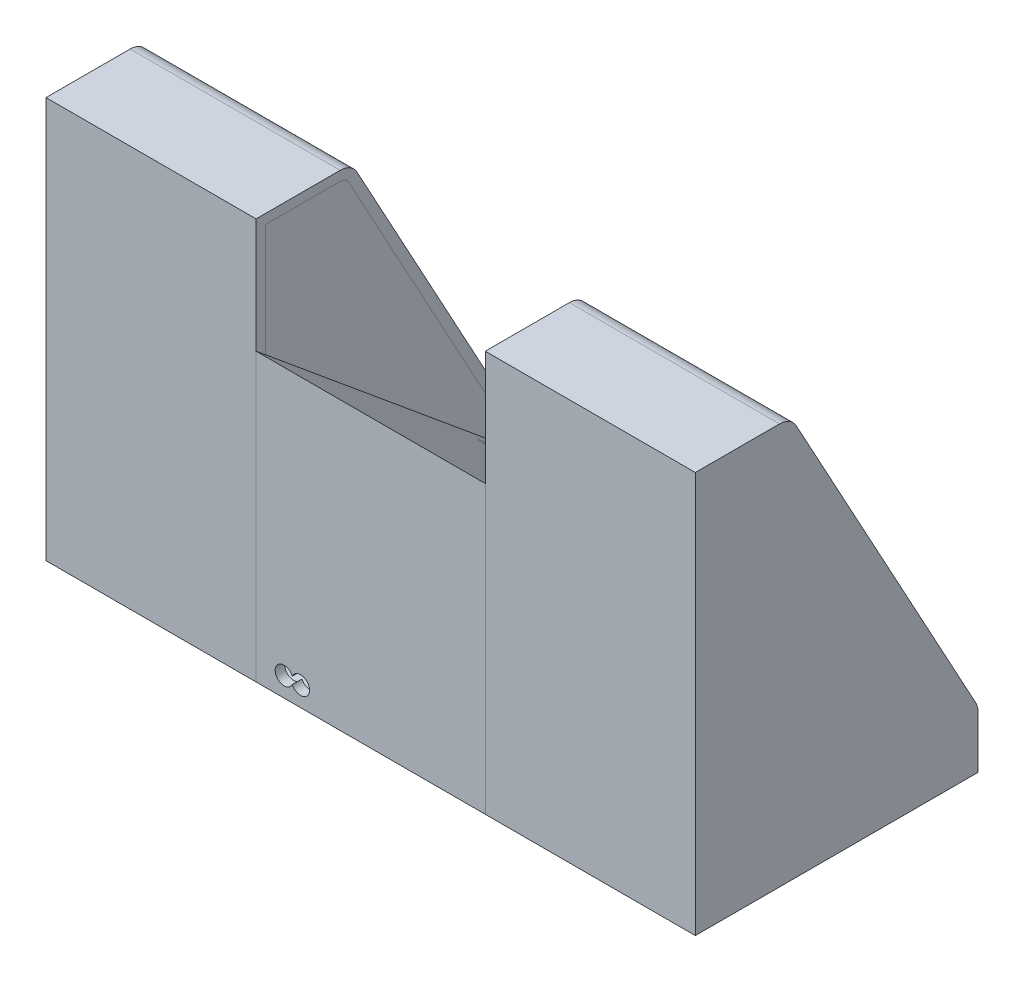
from build123d import *

# Parameters (mm, degrees)
SKETCH1_W               = 148
SKETCH1_H               = 210
BOSS_EXTRUDE1_DEPTH     = 110
SPLIT1_SURFACE_1_BACK   = 280.471
SPLIT1_SURFACE_1_DEPTH  = 560.942
FILLET1_R               = 10
SHELL2_T                = -5
THICKEN1_DEPTH          = 5
BOSS_EXTRUDE2_DEPTH     = 120
FILLET2_R               = 10
SHELL3_T                = -5
SKETCH4_R               = 5
CUT_EXTRUDE1_DEPTH      = 10
CUT_EXTRUDE2_DEPTH      = 5
CUT_EXTRUDE3_DEPTH      = 40
CUT_EXTRUDE3_DEPTH_BACK = 40
FILLET3_R               = 10


# Read off the part's stored shape, not the designer's step: Thicken1
with BuildPart() as part:
    # Sketch1 → Boss-Extrude1 (new body)
    with BuildSketch(Plane(origin=(0, 0, 0), x_dir=(0, 0, -1), z_dir=(1, 0, 0))):
        with Locations((74, 105)):
            Rectangle(SKETCH1_W, SKETCH1_H)
    extrude(amount=BOSS_EXTRUDE1_DEPTH)

    # Split1: cut with a surface, the side behind it stays
    # Split1 surface: a surface, the sketch's curves swept straight by 560.942 mm
    with BuildLine(Plane(origin=(110, 0, 0), x_dir=(0, 0, -1), z_dir=(1, 0, 0)).offset(-SPLIT1_SURFACE_1_BACK), mode=Mode.PRIVATE) as split1_surface_1_path:
        Line((50, 210), (148, 30))
    split1_surface_1 = Shell.extrude(split1_surface_1_path.wire(), (1 * SPLIT1_SURFACE_1_DEPTH, 0 * SPLIT1_SURFACE_1_DEPTH, 0 * SPLIT1_SURFACE_1_DEPTH))
    split(bisect_by=split1_surface_1, keep=Keep.BOTTOM)

    # Fillet1
    fillet1_edges = [part.edges().sort_by_distance(p)[0] for p in [
        (55, 210, -50),
        (55, 30, -148),
    ]]
    fillet(fillet1_edges, radius=FILLET1_R)

    # Shell2
    shell2_openings = [part.faces().sort_by_distance(p)[0] for p in [
        (0, 87.139420884, -57.622655137),
    ]]
    offset(amount=SHELL2_T, openings=shell2_openings, kind=Kind.INTERSECTION)


with BuildPart() as body_2:
    # Thicken1 outline → Thicken1 (new body)
    with BuildSketch(Plane.YZ):
        with BuildLine():
            ThreePointArc((27.454206726, -143), (28.68775727, -142.845446631), (29.845048058, -142.391341222))
            Line((29.845048058, -142.391341222), (202.390841332, -48.449742661))
            ThreePointArc((202.390841332, -48.449742661), (204.298500126, -46.612397656), (205, -44.05840144))
            Line((205, -44.05840144), (205, -5))
            Line((205, -5), (5, -5))
            Line((5, -5), (5, -143))
            Line((5, -143), (27.454206726, -143))
        make_face()
    extrude(amount=THICKEN1_DEPTH)


with BuildPart() as body_3:
    # Mirror1: mirrored copy
    add(part.part.mirror(Plane(origin=(-60, 0, 0), x_dir=(0, 0, 1), z_dir=(1, 0, 0))))


with BuildPart() as body_4:
    # Mirror1 2: mirrored copy
    add(body_2.part.mirror(Plane(origin=(-60, 0, 0), x_dir=(0, 0, 1), z_dir=(1, 0, 0))))


with BuildPart() as body_5:
    # Sketch3 → Boss-Extrude2 (new body)
    with BuildSketch(Plane.ZY):
        Polygon((-148, 27.454206726), (0, 150), (0, 0), (-148, 0), align=None)
    extrude(amount=BOSS_EXTRUDE2_DEPTH)

    # Fillet2
    fillet2_edges = [body_5.edges().sort_by_distance(p)[0] for p in [
        (-60, 27.454206726, -148),
    ]]
    fillet(fillet2_edges, radius=FILLET2_R)

    # Shell3
    shell3_openings = [body_5.faces().sort_by_distance(p)[0] for p in [
        (0, 51.421511448, -56.944660016),
    ]]
    offset(amount=SHELL3_T, openings=shell3_openings, kind=Kind.INTERSECTION)


with BuildPart() as cut_extrude1_tool:
    # Sketch4 → Cut-Extrude1 (new body)
    with BuildSketch(Plane(origin=(-115, 0, 0), x_dir=(0, 0, -1), z_dir=(1, 0, 0))):
        with Locations((25, 15)):
            Circle(SKETCH4_R)
    extrude(amount=-CUT_EXTRUDE1_DEPTH)


with BuildPart() as body_4_1:
    add(body_4.part)

    # Cut-Extrude1: cut by cut_extrude1_tool
    add(cut_extrude1_tool.part, mode=Mode.SUBTRACT)


with BuildPart() as body_5_1:
    add(body_5.part)

    # Cut-Extrude1: cut by cut_extrude1_tool
    add(cut_extrude1_tool.part, mode=Mode.SUBTRACT)

    # Sketch5 → Cut-Extrude2 (cut)
    with BuildSketch(Plane.XY):
        with BuildLine():
            ThreePointArc((-101, 12.147366596), (-110, 10.25), (-101, 8.352633404))
            ThreePointArc((-101, 8.352633404), (-92, 10.25), (-101, 12.147366596))
        make_face()
    extrude(amount=-CUT_EXTRUDE2_DEPTH, mode=Mode.SUBTRACT)

    # Sketch7 → Cut-Extrude3 (cut, two sides: drawn at the far end of the back side and taken through both)
    with BuildSketch(Plane(origin=(-60, 0, 0), x_dir=(0, 0, -1), z_dir=(1, 0, 0)).offset(-CUT_EXTRUDE3_DEPTH_BACK)):
        Polygon((128.0174503, 44), (108.0174503, 44), (108.0174503, 60.560242334), align=None)
    extrude(amount=CUT_EXTRUDE3_DEPTH + CUT_EXTRUDE3_DEPTH_BACK, mode=Mode.SUBTRACT)

    # Fillet3
    # the kernel refuses this fillet: 10 mm, written as the material it takes off along each edge
    with BuildSketch(Plane(origin=(-100, 74.368203197, -91.341413097), x_dir=(-1, 0, 0), z_dir=(0, -0.6377623937017006, -0.77023316546347))) as fillet3_piece_1_section:
        with BuildLine():
            CenterArc((8.660254038, -10), FILLET3_R, 90, 60)
            Line((0, -5), (-0.173205081, -4.9))
            ThreePointArc((-0.173205081, -4.9), (-0.2, -2.5), (-0.2, 0))
            Line((-0.2, 0), (0, 0.2))
            Line((0, 0.2), (8.660254038, 0.2))
            Line((8.660254038, 0.2), (8.660254038, 0))
        make_face()
    fillet3_piece_1 = extrude(amount=69.26743329, mode=Mode.PRIVATE)
    fillet3_piece_1 = split(fillet3_piece_1, bisect_by=Plane(origin=(-102.283215667, 51.522014341, -108.0174503), z_dir=(0, 0, -1)), keep=Keep.TOP, mode=Mode.PRIVATE)
    fillet3_piece_1 = split(fillet3_piece_1, bisect_by=Plane(origin=(-102.283215667, 44, -117.101875744), z_dir=(0, 1, 0)), keep=Keep.TOP, mode=Mode.PRIVATE)
    with BuildSketch(Plane(origin=(-20, 74.368203197, -91.341413097), x_dir=(1, 0, 0), z_dir=(0, -0.6377623937017006, -0.77023316546347))) as fillet3_piece_2_section:
        with BuildLine():
            CenterArc((8.660254038, 10), FILLET3_R, 210, 60)
            Line((0, 5), (-0.173205081, 4.9))
            ThreePointArc((-0.173205081, 4.9), (-0.2, 2.5), (-0.2, 0))
            Line((-0.2, 0), (0, -0.2))
            Line((0, -0.2), (8.660254038, -0.2))
            Line((8.660254038, -0.2), (8.660254038, 0))
        make_face()
    fillet3_piece_2 = extrude(amount=69.26743329, mode=Mode.PRIVATE)
    fillet3_piece_2 = split(fillet3_piece_2, bisect_by=Plane(origin=(-17.716784333, 51.522014341, -108.0174503), z_dir=(0, 0, -1)), keep=Keep.TOP, mode=Mode.PRIVATE)
    fillet3_piece_2 = split(fillet3_piece_2, bisect_by=Plane(origin=(-17.716784333, 44, -117.101875744), z_dir=(0, 1, 0)), keep=Keep.TOP, mode=Mode.PRIVATE)
    with BuildSketch(Plane(origin=(-100, 60.560242334, -108.0174503), x_dir=(0, 0.6377623937017001, 0.7702331654634703), z_dir=(1, 0, 0))) as fillet3_piece_3:
        with BuildLine():
            CenterArc((FILLET3_R * 0.470296038318, FILLET3_R), FILLET3_R, 219.625168474, 50.374831526)
            Line((-FILLET3_R * 0.299937127146, FILLET3_R * 0.362237606298), (-FILLET3_R * 0.315341790455, FILLET3_R * 0.349482358424))
            Line((-FILLET3_R * 0.315341790455, FILLET3_R * 0.349482358424), (-FILLET3_R * 0.00940592076635, -FILLET3_R * 0.02))
            Line((-FILLET3_R * 0.00940592076635, -FILLET3_R * 0.02), (FILLET3_R * 0.470296038318, -FILLET3_R * 0.02))
            Line((FILLET3_R * 0.470296038318, -FILLET3_R * 0.02), (FILLET3_R * 0.470296038318, 0))
        make_face()
    fillet3_piece_3_solid = extrude(amount=80, mode=Mode.PRIVATE)
    with BuildSketch(Plane(origin=(-100, 74.368203197, -91.341413097), x_dir=(-1, 0, 0), z_dir=(0, -0.6377623937017006, -0.77023316546347))) as fillet3_piece_4a_section:
        with BuildLine():
            CenterArc((8.660254038, -10), FILLET3_R, 90, 60)
            Line((0, -5), (-0.173205081, -4.9))
            ThreePointArc((-0.173205081, -4.9), (-0.2, -2.5), (-0.2, 0))
            Line((-0.2, 0), (0, 0.2))
            Line((0, 0.2), (8.660254038, 0.2))
            Line((8.660254038, 0.2), (8.660254038, 0))
        make_face()
    fillet3_piece_4a = extrude(amount=69.26743329, mode=Mode.PRIVATE)
    fillet3_piece_4a = split(fillet3_piece_4a, bisect_by=Plane(origin=(-102.112946333, 66.069674888, -108.0174503), z_dir=(0, 0, 1)), keep=Keep.TOP, mode=Mode.PRIVATE)
    with BuildSketch(Plane(origin=(-111.757400958, 60.560242334, -108.0174503), x_dir=(0, 0.6377623937017026, 0.7702331654634684), z_dir=(1, 0, 0))) as fillet3_piece_4b_section:
        with BuildLine():
            CenterArc((FILLET3_R * 0.470296038318, FILLET3_R), FILLET3_R, 219.625168474, 50.374831526)
            Line((-FILLET3_R * 0.299937127146, FILLET3_R * 0.362237606298), (-FILLET3_R * 0.315341790455, FILLET3_R * 0.349482358424))
            Line((-FILLET3_R * 0.315341790455, FILLET3_R * 0.349482358424), (-FILLET3_R * 0.00940592076635, -FILLET3_R * 0.02))
            Line((-FILLET3_R * 0.00940592076635, -FILLET3_R * 0.02), (FILLET3_R * 0.470296038318, -FILLET3_R * 0.02))
            Line((FILLET3_R * 0.470296038318, -FILLET3_R * 0.02), (FILLET3_R * 0.470296038318, 0))
        make_face()
    fillet3_piece_4b = extrude(amount=91.757400958, mode=Mode.PRIVATE)
    fillet3_piece_4b = split(fillet3_piece_4b, bisect_by=Plane(origin=(-100, 60.196176362, -107.243329443), z_dir=(-1, 0, 0)), keep=Keep.TOP, mode=Mode.PRIVATE)
    fillet3_piece_4 = fillet3_piece_4a & fillet3_piece_4b
    with BuildSketch(Plane(origin=(-100, 60.560242334, -108.0174503), x_dir=(0, 0.6377623937017001, 0.7702331654634703), z_dir=(1, 0, 0))) as fillet3_piece_5a_section:
        with BuildLine():
            CenterArc((FILLET3_R * 0.470296038318, FILLET3_R), FILLET3_R, 219.625168474, 50.374831526)
            Line((-FILLET3_R * 0.299937127146, FILLET3_R * 0.362237606298), (-FILLET3_R * 0.315341790455, FILLET3_R * 0.349482358424))
            Line((-FILLET3_R * 0.315341790455, FILLET3_R * 0.349482358424), (-FILLET3_R * 0.00940592076635, -FILLET3_R * 0.02))
            Line((-FILLET3_R * 0.00940592076635, -FILLET3_R * 0.02), (FILLET3_R * 0.470296038318, -FILLET3_R * 0.02))
            Line((FILLET3_R * 0.470296038318, -FILLET3_R * 0.02), (FILLET3_R * 0.470296038318, 0))
        make_face()
    fillet3_piece_5a = extrude(amount=91.757400958, mode=Mode.PRIVATE)
    fillet3_piece_5a = split(fillet3_piece_5a, bisect_by=Plane(origin=(-20, 60.196176362, -107.243329443), z_dir=(1, 0, 0)), keep=Keep.TOP, mode=Mode.PRIVATE)
    with BuildSketch(Plane(origin=(-20, 74.368203197, -91.341413097), x_dir=(1, 0, 0), z_dir=(0, -0.6377623937017006, -0.77023316546347))) as fillet3_piece_5b_section:
        with BuildLine():
            CenterArc((8.660254038, 10), FILLET3_R, 210, 60)
            Line((0, 5), (-0.173205081, 4.9))
            ThreePointArc((-0.173205081, 4.9), (-0.2, 2.5), (-0.2, 0))
            Line((-0.2, 0), (0, -0.2))
            Line((0, -0.2), (8.660254038, -0.2))
            Line((8.660254038, -0.2), (8.660254038, 0))
        make_face()
    fillet3_piece_5b = extrude(amount=69.26743329, mode=Mode.PRIVATE)
    fillet3_piece_5b = split(fillet3_piece_5b, bisect_by=Plane(origin=(-17.887053667, 66.069674888, -108.0174503), z_dir=(0, 0, 1)), keep=Keep.TOP, mode=Mode.PRIVATE)
    fillet3_piece_5 = fillet3_piece_5a & fillet3_piece_5b
    add([fillet3_piece_1, fillet3_piece_2, fillet3_piece_3_solid, fillet3_piece_4, fillet3_piece_5], mode=Mode.SUBTRACT)


solid = Compound([part.part, body_2.part, body_3.part, body_4_1.part, body_5_1.part])
